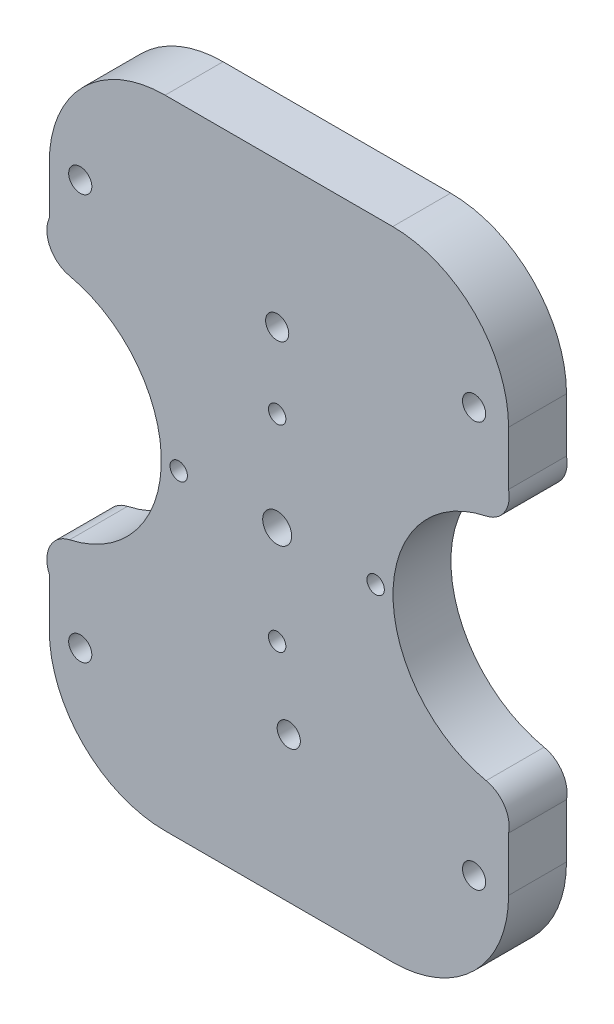
from build123d import *

# Parameters (mm, degrees)
SKETCH1_R           = 47.5
SKETCH1_R_2         = 2.5
SKETCH1_R_3         = 1.5
BOSS_EXTRUDE1_DEPTH = 10
SKETCH7_W           = 79.294879448
SKETCH7_H           = 30
BOSS_EXTRUDE3_DEPTH = 10
SKETCH3_R           = 2
CUT_EXTRUDE1_DEPTH  = 10
CUT_EXTRUDE2_START  = -10
CUT_EXTRUDE2_DEPTH  = 10
FILLET2_R           = 5
FILLET3_R           = 20
SKETCH8_R           = 2
CUT_EXTRUDE3_DEPTH  = 20


with BuildPart() as part:
    # Sketch1 → Boss-Extrude1 (new body)
    with BuildSketch(Plane.XY):
        Circle(SKETCH1_R)
        Circle(SKETCH1_R_2, mode=Mode.SUBTRACT)
        with Locations((0, 17)):
            Circle(SKETCH1_R_3, mode=Mode.SUBTRACT)
        with Locations((17, 0)):
            Circle(SKETCH1_R_3, mode=Mode.SUBTRACT)
        with Locations((0, -17)):
            Circle(SKETCH1_R_3, mode=Mode.SUBTRACT)
        with Locations((-17, 0)):
            Circle(SKETCH1_R_3, mode=Mode.SUBTRACT)
    extrude(amount=BOSS_EXTRUDE1_DEPTH)

    # Sketch7 → Boss-Extrude3 (add)
    with BuildSketch(Plane(origin=(0, 0, 0), x_dir=(-1, 0, 0), z_dir=(0, 0, -1))):
        with Locations((-0.305848536, 40)):
            Rectangle(SKETCH7_W, SKETCH7_H)
        with Locations((-0.305848536, -40)):
            Rectangle(SKETCH7_W, SKETCH7_H)
    extrude(amount=-BOSS_EXTRUDE3_DEPTH)

    # Sketch3 → Cut-Extrude1 (cut)
    with BuildSketch(Plane.XY.offset(10)):
        with Locations((-34, 35)):
            Circle(SKETCH3_R)
        with Locations((34, 35)):
            Circle(SKETCH3_R)
    cut_extrude1 = extrude(amount=-CUT_EXTRUDE1_DEPTH, mode=Mode.SUBTRACT)

    # Mirror1: Cut-Extrude1 across plane
    add(cut_extrude1.mirror(Plane.ZX), mode=Mode.SUBTRACT)

    # Sketch4 → Cut-Extrude2 (cut)
    with BuildSketch(Plane.XY.offset(10).offset(CUT_EXTRUDE2_START)):
        with BuildLine():
            ThreePointArc((-43.084219849, 20), (-47.5, 0), (-43.084219849, -20))
            ThreePointArc((-43.084219849, -20), (-20, 0), (-43.084219849, 20))
        make_face()
        with BuildLine():
            ThreePointArc((43.084219849, 20), (47.5, 0), (43.084219849, -20))
            ThreePointArc((43.084219849, -20), (20, 0), (43.084219849, 20))
        make_face()
    extrude(amount=CUT_EXTRUDE2_DEPTH, mode=Mode.SUBTRACT)

    # Fillet2
    # the kernel refuses this fillet: 5 mm, written as the material it takes off along each edge
    with BuildSketch(Plane(origin=(43.084219849, -20, -17.522188683), x_dir=(-0.4820770193525399, -0.8761288417876509, 0), z_dir=(0, 0, 1))) as fillet2_piece_1:
        with BuildLine():
            CenterArc((7.965064209, -4.7789061), FILLET2_R, 107.102298128, 89.932791817)
            Line((3.18443662, -6.243692723), (3.088824068, -6.272988455))
            ThreePointArc((3.088824068, -6.272988455), (1.775921643, -3.02815315), (-0.079852724, -0.060195867))
            Line((-0.079852724, -0.060195867), (-0.006836496, 0.099766038))
            ThreePointArc((-0.006836496, 0.099766038), (3.24733545, 0.211131977), (6.465263034, 0.095578122))
            Line((6.465263034, 0.095578122), (6.4946709, 0))
        make_face()
    extrude(amount=45.044377366, mode=Mode.SUBTRACT)
    with BuildSketch(Plane(origin=(43.084219849, 20, -17.522188683), x_dir=(-0.9995074123131517, -0.03138363795144594, 0), z_dir=(0, 0, 1))) as fillet2_piece_2:
        with BuildLine():
            CenterArc((7.876051386, -4.92422643), FILLET2_R, 99.987608256, 89.932791817)
            Line((2.950811143, -5.78562561), (2.852306338, -5.802853594))
            ThreePointArc((2.852306338, -5.802853594), (1.28732359, -2.988739235), (-0.091980358, -0.039237913))
            Line((-0.091980358, -0.039237913), (0.017343518, 0.098484529))
            ThreePointArc((0.017343518, 0.098484529), (3.504437737, -0.206216713), (6.991531955, 0.098484529))
            Line((6.991531955, 0.098484529), (7.008875473, 0))
        make_face()
    extrude(amount=45.044377366, mode=Mode.SUBTRACT)
    with BuildSketch(Plane(origin=(-43.084219849, 20, -19.006257622), x_dir=(0.9993011358017984, -0.037379673423339595, 0), z_dir=(0, 0, 1))) as fillet2_piece_3:
        with BuildLine():
            CenterArc((8.144232965, 4.918935136), FILLET2_R, 158.484077447, 101.184563019)
            Line((3.49265456, 6.752734019), (3.399622992, 6.789409997))
            ThreePointArc((3.399622992, 6.789409997), (1.522188613, 3.492296192), (-0.092214112, 0.038685366))
            Line((-0.092214112, 0.038685366), (0.01793407, -0.098378703))
            ThreePointArc((0.01793407, -0.098378703), (3.623764745, 0.227599929), (7.22959542, -0.098378703))
            Line((7.22959542, -0.098378703), (7.247529489, 0))
        make_face()
    extrude(amount=48.012515244, mode=Mode.SUBTRACT)
    with BuildSketch(Plane(origin=(-43.084219849, -20, -19.006257622), x_dir=(0.4922890050047702, -0.8704318098228104, 0), z_dir=(0, 0, 1))) as fillet2_piece_4:
        with BuildLine():
            CenterArc((8.110651537, 4.97411149), FILLET2_R, 162.982413534, 101.184563019)
            Line((3.329576688, 6.437437594), (3.233955191, 6.466704116))
            ThreePointArc((3.233955191, 6.466704116), (1.866948313, 3.114157454), (-0.079143369, 0.061125503))
            Line((-0.079143369, 0.061125503), (-0.008002635, -0.099679275))
            ThreePointArc((-0.008002635, -0.099679275), (3.801251524, -0.252344442), (7.592340079, -0.09948223))
            Line((7.592340079, -0.09948223), (7.602503049, 0))
        make_face()
    extrude(amount=48.012515244, mode=Mode.SUBTRACT)

    # Fillet3
    fillet3_edges = [part.edges().sort_by_distance(p)[0] for p in [
        (-39.341591188, 55, 5),
        (39.95328826, 55, 5),
        (39.95328826, -55, 5),
        (-39.341591188, -55, 5),
    ]]
    fillet(fillet3_edges, radius=FILLET3_R)

    # Sketch8 → Cut-Extrude3 (cut)
    with BuildSketch(Plane(origin=(0, 0, 0), x_dir=(-1, 0, 0), z_dir=(0, 0, -1))):
        with Locations((0, 30)):
            Circle(SKETCH8_R)
        with Locations((-2, -29.933259094)):
            Circle(SKETCH8_R)
    extrude(amount=-CUT_EXTRUDE3_DEPTH, mode=Mode.SUBTRACT)


solid = part.part
